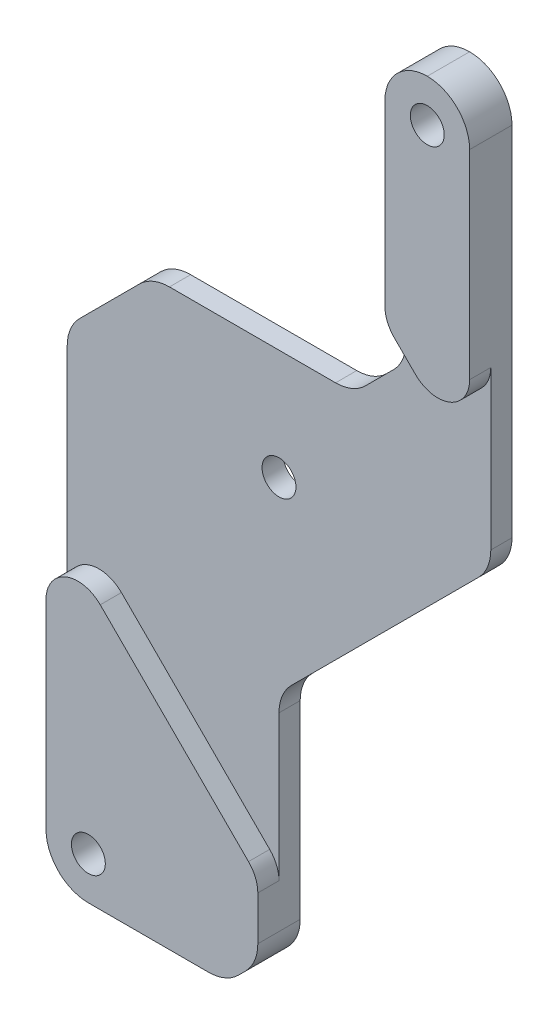
from build123d import *

# Parameters (mm, degrees)
BOSS_EXTRUDE1_DEPTH = 4
FILLET1_R           = 4
CHAMFER1_SIZE       = 3
CHAMFER2_SIZE       = 5
FILLET2_R           = 4
SKETCH2_R           = 1.6
CUT_EXTRUDE1_DEPTH  = 142.477913471
CUT_EXTRUDE2_DEPTH  = 2
FILLET3_R           = 3
SKETCH4_R           = 1.6
CUT_EXTRUDE3_DEPTH  = 142.477913471


with BuildPart() as part:
    # Sketch1 → Boss-Extrude1 (new body)
    with BuildSketch(Plane.XY):
        Polygon((-12, -87.8), (12, -87.8), (12, -56.4), (20, -56.4), (20, -95.8), (0, -115.8), (0, -140), (-20, -140), (-20, -95.8), align=None)
    extrude(amount=BOSS_EXTRUDE1_DEPTH)

    # Fillet1
    fillet1_edges = [part.edges().sort_by_distance(p)[0] for p in [
        (12, -56.4, 2),
        (20, -56.4, 2),
        (-20, -140, 2),
    ]]
    fillet(fillet1_edges, radius=FILLET1_R - 0.0001)  # a hair under: the kernel refuses the full size

    # Chamfer1
    chamfer1_edges = [part.edges().sort_by_distance(p)[0] for p in [
        (0, -140, 2),
    ]]
    chamfer(chamfer1_edges, length=CHAMFER1_SIZE)

    # Chamfer2
    chamfer2_edges = [part.edges().sort_by_distance(p)[0] for p in [
        (12, -87.8, 2),
    ]]
    chamfer(chamfer2_edges, length=CHAMFER2_SIZE)

    # Fillet2
    fillet2_edges = [part.edges().sort_by_distance(p)[0] for p in [
        (0, -115.8, 2),
        (20, -95.8, 2),
        (-12, -87.8, 2),
        (-20, -95.8, 2),
        (0, -137, 2),
        (-3, -140, 2),
        (7, -87.8, 2),
        (12, -82.8, 2),
    ]]
    fillet(fillet2_edges, radius=FILLET2_R)

    # Sketch2 → Cut-Extrude1 (cut, through all)
    with BuildSketch(Plane.XY.offset(4)):
        with Locations((0, -98.2)):
            Circle(SKETCH2_R)
    extrude(amount=-CUT_EXTRUDE1_DEPTH, mode=Mode.SUBTRACT)

    # Sketch3 → Cut-Extrude2 (cut)
    with BuildSketch(Plane.XY.offset(4)):
        Polygon((0, -129.942135624), (31.742135624, -98.2), (0, -66.457864376), (-31.742135624, -98.2), align=None)
    extrude(amount=-CUT_EXTRUDE2_DEPTH, mode=Mode.SUBTRACT)

    # Fillet3
    fillet3_edges = [part.edges().sort_by_distance(p)[0] for p in [
        (-20, -109.942135624, 3),
        (20, -86.457864376, 3),
        (12, -78.457864376, 3),
        (0, -129.942135624, 3),
    ]]
    fillet(fillet3_edges, radius=FILLET3_R)

    # Sketch4 → Cut-Extrude3 (cut, through all)
    with BuildSketch(Plane.XY.offset(4)):
        with Locations((-16, -136)):
            Circle(SKETCH4_R)
        with Locations((16, -60.4)):
            Circle(SKETCH4_R)
    extrude(amount=-CUT_EXTRUDE3_DEPTH, mode=Mode.SUBTRACT)


solid = part.part
